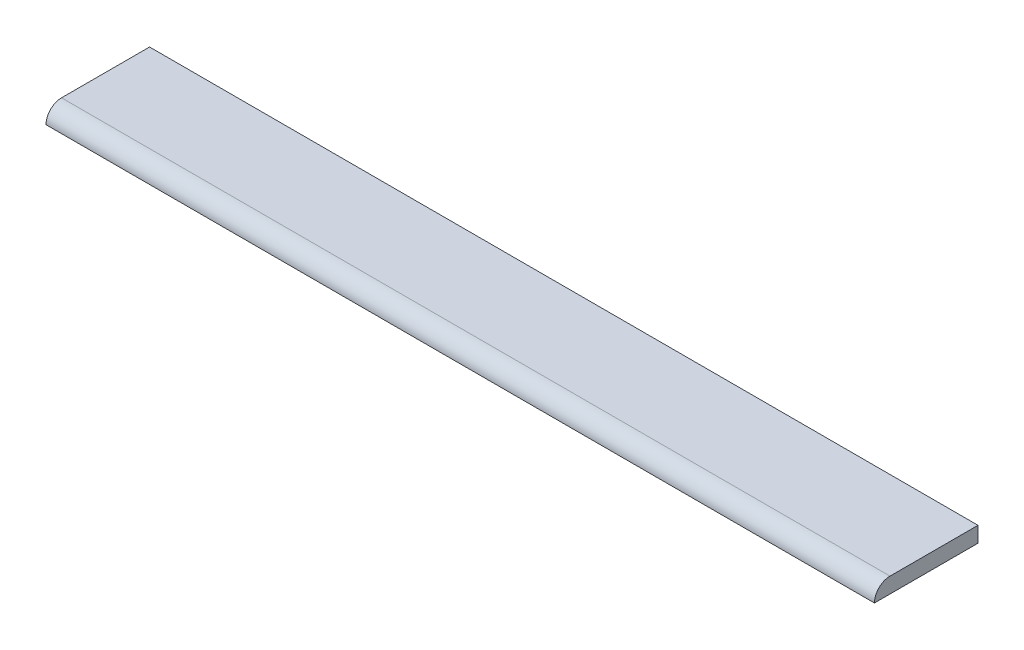
from build123d import *

# Parameters (mm, degrees)
ESBO_O1_W                = 160
ESBO_O1_H                = 20
RESSALTO_EXTRUS_O1_DEPTH = 3
FILETE2_R                = 3


with BuildPart() as part:
    # Esboço1 → Ressalto-extrusão1 (new body)
    with BuildSketch(Plane(origin=(0, 0, 0), x_dir=(1, 0, 0), z_dir=(0, 1, 0))):
        with Locations((41.735785703, -3.037439614)):
            Rectangle(ESBO_O1_W, ESBO_O1_H)
    extrude(amount=RESSALTO_EXTRUS_O1_DEPTH)

    # Filete2
    filete2_edges = [part.edges().sort_by_distance(p)[0] for p in [
        (41.735785703, 3, 13.037439614),
    ]]
    fillet(filete2_edges, radius=FILETE2_R - 0.0001)  # a hair under: the kernel refuses the full size


solid = part.part
